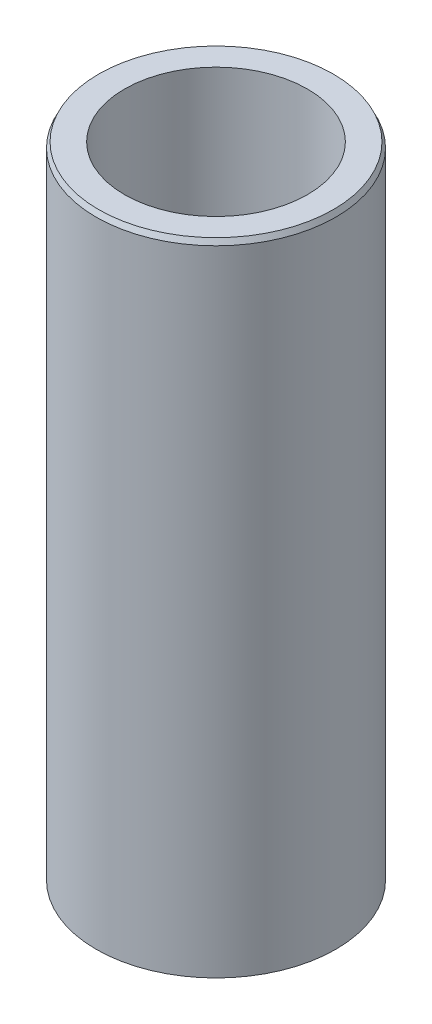
from build123d import *
from OCP.BRepFilletAPI import BRepFilletAPI_MakeChamfer

# Parameters (mm, degrees)
SKETCH1_R           = 40
BOSS_EXTRUDE1_DEPTH = 214.181819223
SKETCH2_R           = 30.533715275
CUT_EXTRUDE1_DEPTH  = 222.526187359
CHAMFER1_SIZE       = 1.7670141
CHAMFER1_SIZE2      = 0.837243442


with BuildPart() as part:
    # Sketch1 → Boss-Extrude1 (new body)
    with BuildSketch(Plane(origin=(0, 0, 0), x_dir=(1, 0, 0), z_dir=(0, 1, 0))):
        Circle(SKETCH1_R)
    extrude(amount=BOSS_EXTRUDE1_DEPTH)

    # Sketch2 → Cut-Extrude1 (cut, through all)
    with BuildSketch(Plane(origin=(0, 0, 0), x_dir=(1, 0, 0), z_dir=(0, 1, 0))):
        Circle(SKETCH2_R)
    extrude(amount=CUT_EXTRUDE1_DEPTH, mode=Mode.SUBTRACT)

    # Chamfer1: one chamfer whose edges measure the first distance from different faces: ONE call of the kernel's chamfer builder (chamfer() names one face for all edges)
    chamfer1_edges_1 = [part.edges().sort_by_distance(p)[0] for p in [
        (-40, 214.181819223, 0),
    ]]
    chamfer1_side_1 = [part.faces().sort_by_distance(p)[0] for p in [
        (-40, 107.090909611, 0),
    ]]
    chamfer1_edges_2 = [part.edges().sort_by_distance(p)[0] for p in [
        (-40, 0, 0),
    ]]
    chamfer1_side_2 = [part.faces().sort_by_distance(p)[0] for p in [
        (-38.86862915, 0, 0),
    ]]
    chamfer1 = BRepFilletAPI_MakeChamfer(part.part.solid().wrapped)
    for e in chamfer1_edges_1:
        chamfer1.Add(CHAMFER1_SIZE, CHAMFER1_SIZE2, e.wrapped, chamfer1_side_1[0].wrapped)  # the first distance lies on this face
    for e in chamfer1_edges_2:
        chamfer1.Add(CHAMFER1_SIZE, CHAMFER1_SIZE2, e.wrapped, chamfer1_side_2[0].wrapped)  # the first distance lies on this face
    add(Compound.cast(chamfer1.Shape()), mode=Mode.REPLACE)


solid = part.part
